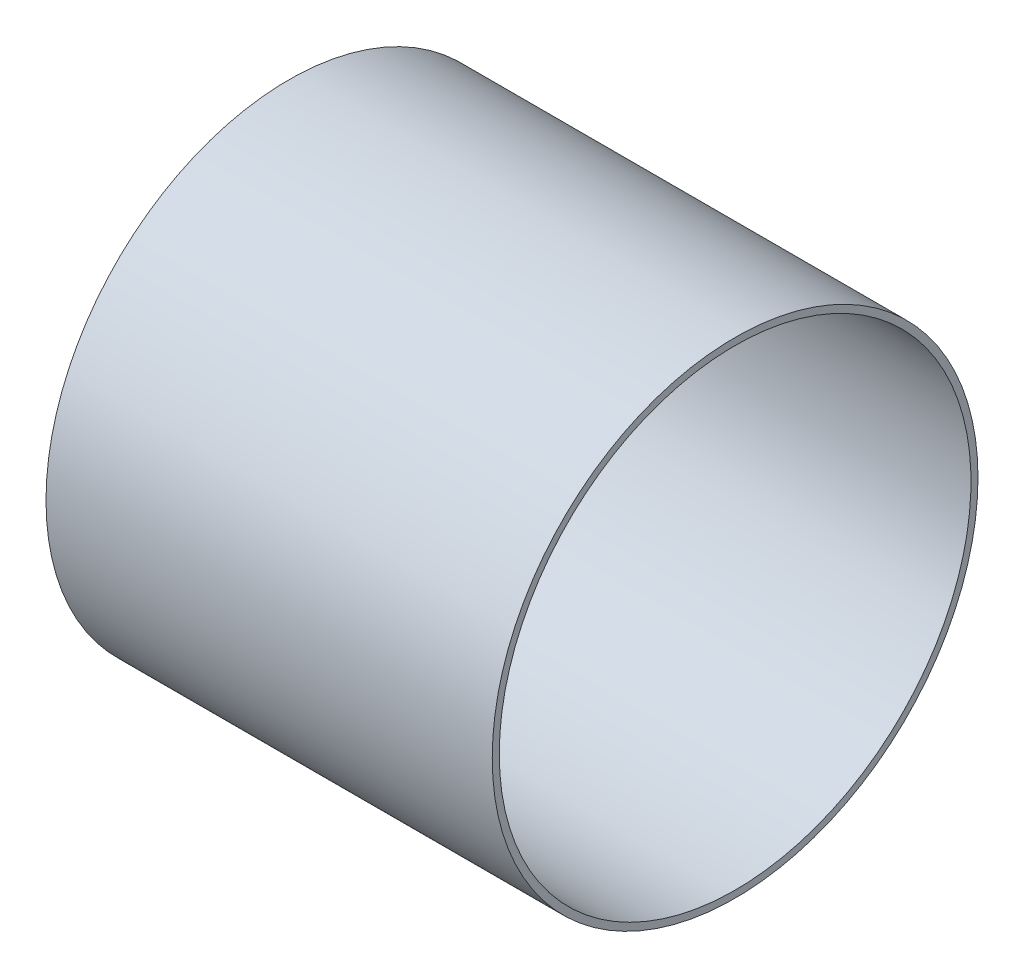
from build123d import *

# Parameters (mm, degrees)
SKETCH1_R           = 57.15
SKETCH1_R_2         = 55.499
BOSS_EXTRUDE1_DEPTH = 105.00094


with BuildPart() as part:
    # Sketch1 → Boss-Extrude1 (new body)
    with BuildSketch(Plane(origin=(0, 0, 0), x_dir=(0, 0, -1), z_dir=(1, 0, 0))):
        Circle(SKETCH1_R)
        Circle(SKETCH1_R_2, mode=Mode.SUBTRACT)
    extrude(amount=BOSS_EXTRUDE1_DEPTH)


solid = part.part
